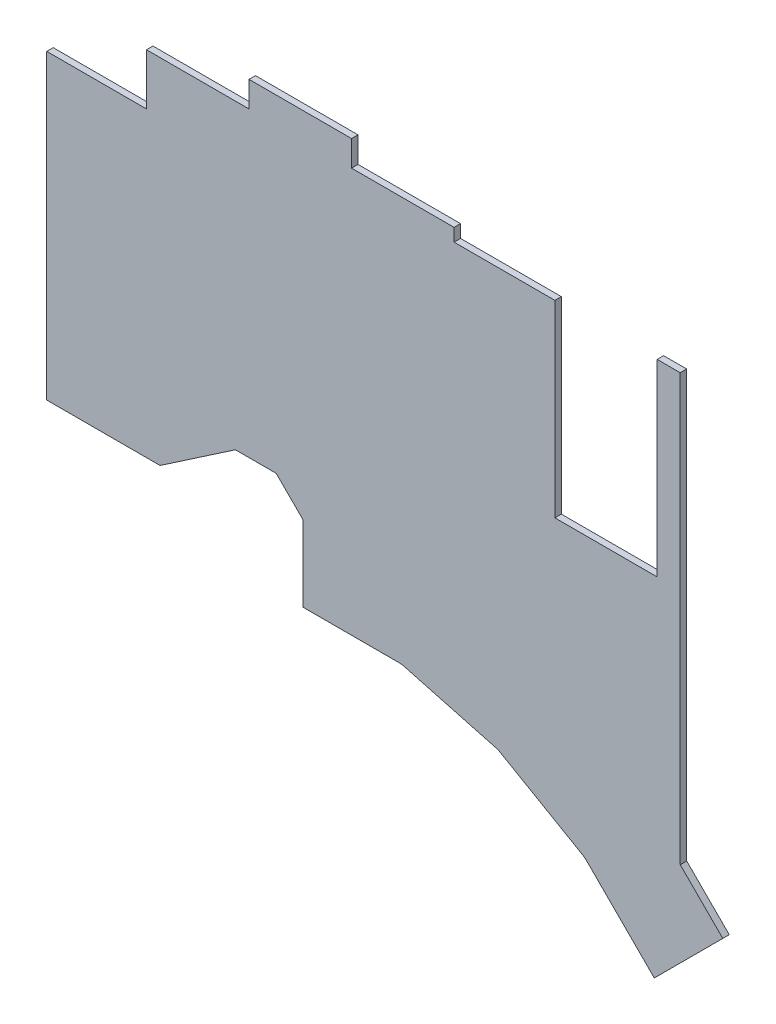
from build123d import *

# Parameters (mm, degrees)
BOSS_EXTRU_1_DEPTH = 1.2


with BuildPart() as part:
    # Esquisse4 → Boss.-Extru.1 (new body)
    with BuildSketch(Plane.XY):
        Polygon((19.6697, 93.5719), (19.6697, 37.4727), (40.7197, 37.4727), (54.719, 46.9977), (62.2947, 46.9977), (67.2947, 41.9977), (67.2947, 27.9475), (85.294, 27.9475), (85.855576347, 27.875377355), (103.243212902, 23.215478929), (103.766191837, 22.998072873), (119.355185114, 13.998785183), (119.804572875, 13.653575715), (132.532309311, 0.926057837), (145.259827189, 13.653794272), (137.352256666, 21.561229009), (137.352256666, 100.7157), (136.259827189, 100.7157), (135.259827189, 100.7157), (133.065352358, 100.7157), (133.065352358, 97.734506516), (133.065352358, 66.721178185), (133.065352358, 65.721178185), (114.065352358, 65.721178185), (114.065352358, 66.721178185), (114.065352358, 97.734506516), (114.065352358, 100.7157), (95.34435, 100.7157), (95.34435, 103.097), (76.29435, 103.097), (76.29435, 107.859), (57.24435, 107.859), (57.24435, 103.097), (38.19435, 103.097), (38.19435, 93.5719), align=None)
    extrude(amount=BOSS_EXTRU_1_DEPTH)


solid = part.part
